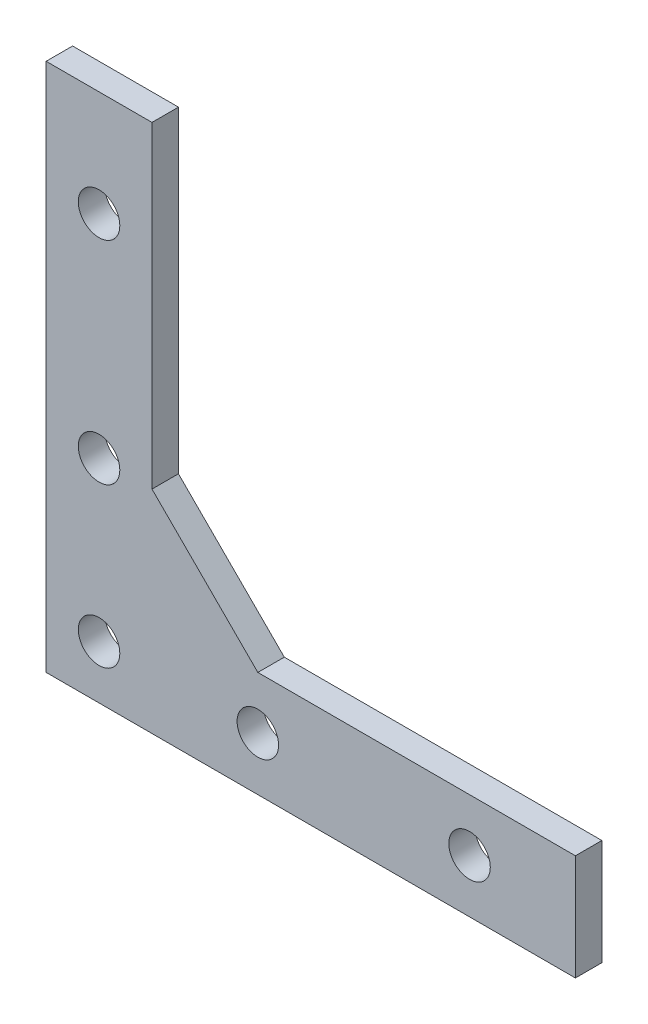
from build123d import *

# Parameters (mm, degrees)
BOSS_EXTRUDE1_DEPTH    = 3.175
F_10_CLEARANCE_HOLE1_D = 4.9784


with BuildPart() as part:
    # Sketch1 → Boss-Extrude1 (new body)
    with BuildSketch(Plane.XY):
        Polygon((-253.5966335, 0), (-266.700000508, 0), (-266.700000508, 63.5), (-254.000000508, 63.5), (-254.000000508, 25.4), (-241.300000508, 12.7), (-203.200000508, 12.7), (-203.200000508, 0), align=None)
    extrude(amount=BOSS_EXTRUDE1_DEPTH)

    # #10 Clearance Hole1 (through all)
    with Locations(Plane.XY.offset(3.175)):
        with Locations((-260.350000508, 6.388229415), (-260.350000508, 25.438229415), (-260.350000508, 50.838229415), (-241.300000508, 6.388229415), (-215.900000508, 6.388229415)):
            Hole(F_10_CLEARANCE_HOLE1_D / 2)


solid = part.part
